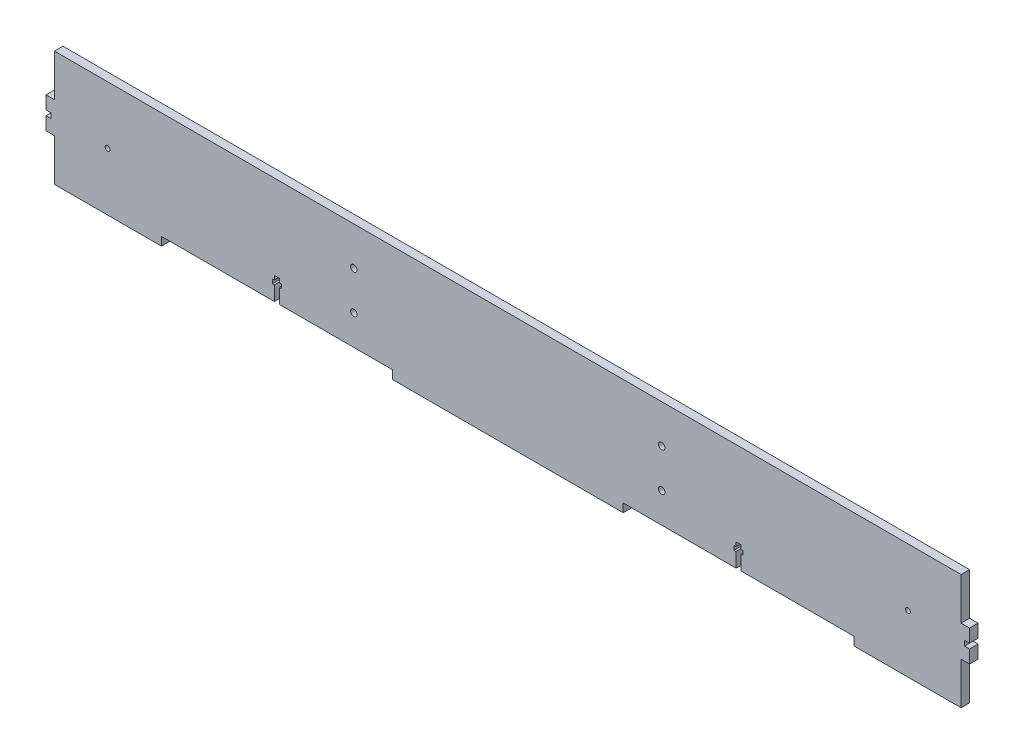
from build123d import *

# Parameters (mm, degrees)
BOSS_EXTRUDE1_DEPTH = 5.5
SKETCH2_R           = 2.1
CUT_EXTRUDE1_DEPTH  = 907.379197687
SKETCH3_R           = 1.6
CUT_EXTRUDE2_DEPTH  = 907.379197687


with BuildPart() as part:
    # Sketch1 → Boss-Extrude1 (new body)
    with BuildSketch(Plane.XY):
        Polygon((308.5, 78), (308.5, 50.625), (303, 50.625), (303, 42.125), (306.25, 42.125), (306.25, 40.5), (306.25, 38.875), (303, 38.875), (303, 30.375), (308.5, 30.375), (308.5, 3), (378, 3), (378, 8.5), (451.375, 8.5), (451.375, 17.95), (450.125, 17.95), (450.125, 20.6), (451.375, 20.6), (451.375, 23.25), (454.625, 23.25), (454.625, 20.6), (455.875, 20.6), (455.875, 17.95), (454.625, 17.95), (454.625, 8.5), (528, 8.5), (528, 3), (678, 3), (678, 8.5), (751.375, 8.5), (751.375, 17.95), (750.125, 17.95), (750.125, 20.6), (751.375, 20.6), (751.375, 23.25), (754.625, 23.25), (754.625, 20.6), (755.875, 20.6), (755.875, 17.95), (754.625, 17.95), (754.625, 8.5), (828, 8.5), (828, 3), (897.5, 3), (897.5, 30.375), (903, 30.375), (903, 38.875), (899.75, 38.875), (899.75, 40.5), (899.75, 42.125), (903, 42.125), (903, 50.625), (897.5, 50.625), (897.5, 78), align=None)
    extrude(amount=BOSS_EXTRUDE1_DEPTH)

    # Sketch2 → Cut-Extrude1 (cut, through all)
    with BuildSketch(Plane.XY.offset(5.5)):
        with Locations((503, 53)):
            Circle(SKETCH2_R)
        with Locations((503, 28)):
            Circle(SKETCH2_R)
        with Locations((703, 28)):
            Circle(SKETCH2_R)
        with Locations((703, 53)):
            Circle(SKETCH2_R)
    extrude(amount=-CUT_EXTRUDE1_DEPTH, mode=Mode.SUBTRACT)

    # Sketch3 → Cut-Extrude2 (cut, through all)
    with BuildSketch(Plane.XY.offset(5.5)):
        with Locations((343, 40.5)):
            Circle(SKETCH3_R)
        with Locations((863, 40.5)):
            Circle(SKETCH3_R)
    extrude(amount=-CUT_EXTRUDE2_DEPTH, mode=Mode.SUBTRACT)


solid = part.part
